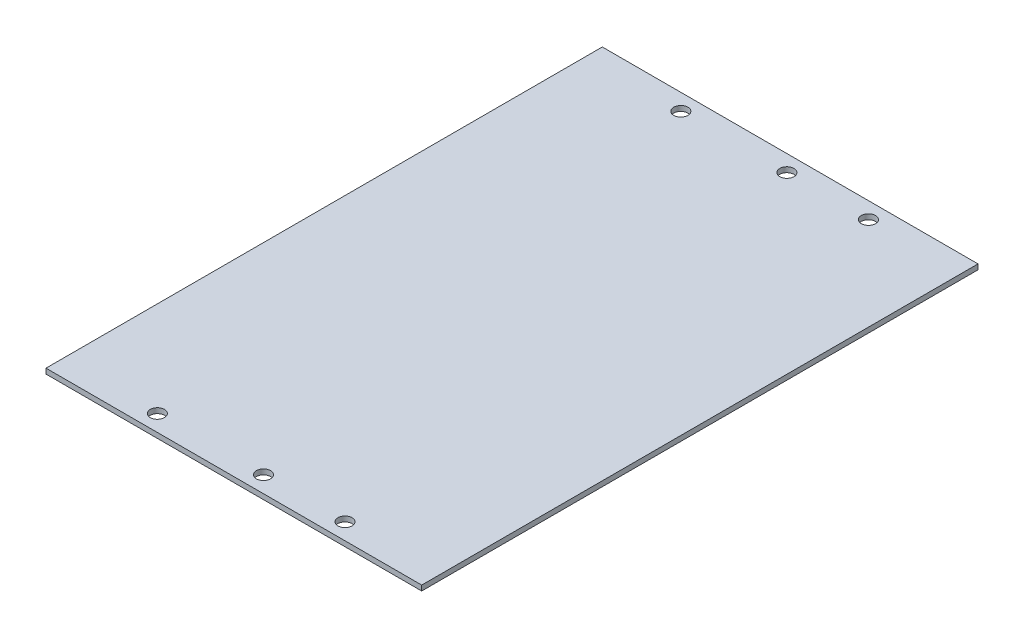
from build123d import *

# Parameters (mm, degrees)
SKETCH1_W           = 145.2
SKETCH1_H           = 214.995
SKETCH1_R           = 2.75
BOSS_EXTRUDE1_DEPTH = 2


with BuildPart() as part:
    # Sketch1 → Boss-Extrude1 (new body)
    with BuildSketch(Plane(origin=(0, 0, 0), x_dir=(1, 0, 0), z_dir=(0, 1, 0))):
        with Locations((78.3, 107.5025)):
            Rectangle(SKETCH1_W, SKETCH1_H)
        with Locations((42.4, 208.65)):
            Circle(SKETCH1_R, mode=Mode.SUBTRACT)
        with Locations((83.4, 208.65)):
            Circle(SKETCH1_R, mode=Mode.SUBTRACT)
        with Locations((114.9, 208.65)):
            Circle(SKETCH1_R, mode=Mode.SUBTRACT)
        with Locations((114.9, 6.355)):
            Circle(SKETCH1_R, mode=Mode.SUBTRACT)
        with Locations((83.4, 6.355)):
            Circle(SKETCH1_R, mode=Mode.SUBTRACT)
        with Locations((42.4, 6.355)):
            Circle(SKETCH1_R, mode=Mode.SUBTRACT)
    extrude(amount=BOSS_EXTRUDE1_DEPTH)


solid = part.part
